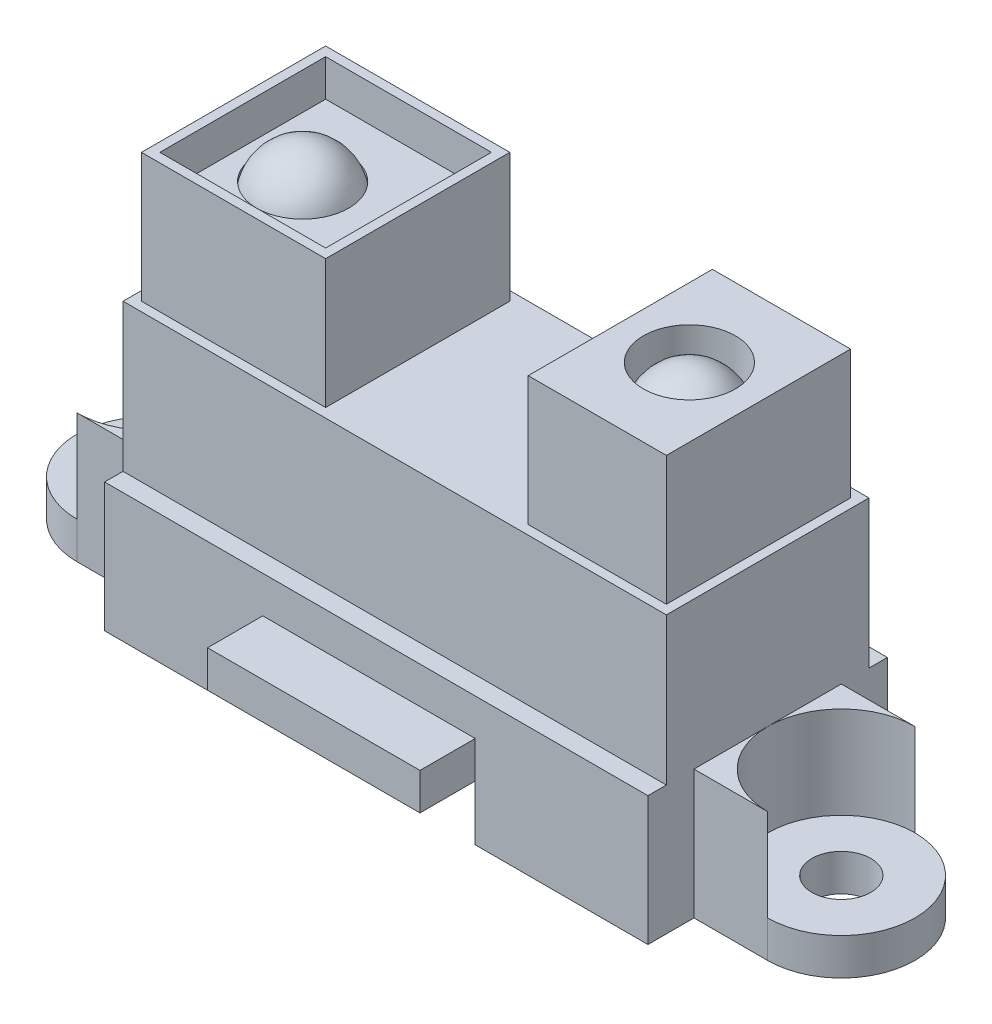
from build123d import *

# Parameters (mm, degrees)
EXTRUDE_1_DEPTH     = 7
CUT_EXTRUDE_START   = -5
SKETCH_2_R          = 4
CUT_EXTRUDE_1_DEPTH = 5
SKETCH_3_W          = 29.5
SKETCH_3_H          = 11
EXTRUDE_2_DEPTH     = 8
SKETCH_4_W          = 7.5
SKETCH_4_H          = 10
SKETCH_4_W_2        = 10
EXTRUDE_3_DEPTH     = 7
SKETCH_5_W          = 9
SKETCH_5_H          = 9
CUT_EXTRUDE_2_DEPTH = 2
SKETCH_6_R          = 2.5
CUT_EXTRUDE_3_DEPTH = 2.2
SKETCH_7_R          = 1.6
CUT_EXTRUDE_4_DEPTH = 45.443784717
SKETCH_8_W          = 11.533749137
SKETCH_8_H          = 5
EXTRUDE_4_DEPTH     = 3
CUT_EXTRUDE_5_DEPTH = 3


# Read off the part's stored shape, not the designer's step: 圆顶1, 圆顶2
with BuildPart() as part:
    # 草图1 → 凸台-拉伸1 (new body)
    with BuildSketch(Plane(origin=(0, 0, 0), x_dir=(1, 0, 0), z_dir=(0, 1, 0))):
        with BuildLine():
            Line((0, 0), (29.5, 0))
            Line((29.5, 0), (29.5, -2.5))
            Line((29.5, -2.5), (33.5, -2.5))
            ThreePointArc((33.5, -2.5), (37.5, -6.5), (33.5, -10.5))
            Line((33.5, -10.5), (29.5, -10.5))
            Line((29.5, -10.5), (29.5, -13))
            Line((29.5, -13), (0, -13))
            Line((0, -13), (0, -10.5))
            Line((0, -10.5), (-4, -10.5))
            ThreePointArc((-4, -10.5), (-8, -6.5), (-4, -2.5))
            Line((-4, -2.5), (0, -2.5))
            Line((0, -2.5), (0, 0))
        make_face()
    extrude(amount=EXTRUDE_1_DEPTH)

    # 草图2 → 切除-拉伸1 (cut)
    with BuildSketch(Plane(origin=(0, 7, 0), x_dir=(1, 0, 0), z_dir=(0, 1, 0)).offset(CUT_EXTRUDE_START)):
        with Locations((-4, -6.5)):
            Circle(SKETCH_2_R)
        with Locations((33.5, -6.5)):
            Circle(SKETCH_2_R)
    extrude(amount=CUT_EXTRUDE_1_DEPTH, mode=Mode.SUBTRACT)

    # 草图3 → 凸台-拉伸2 (add)
    with BuildSketch(Plane(origin=(0, 7, 0), x_dir=(1, 0, 0), z_dir=(0, 1, 0))):
        with Locations((14.75, -6.5)):
            Rectangle(SKETCH_3_W, SKETCH_3_H)
    extrude(amount=EXTRUDE_2_DEPTH)

    # 草图4 → 凸台-拉伸3 (add)
    with BuildSketch(Plane(origin=(0, 15, 0), x_dir=(1, 0, 0), z_dir=(0, 1, 0))):
        with Locations((25.25, -6.5)):
            Rectangle(SKETCH_4_W, SKETCH_4_H)
        with Locations((5.5, -6.5)):
            Rectangle(SKETCH_4_W_2, SKETCH_4_H)
    extrude(amount=EXTRUDE_3_DEPTH)

    # 草图5 → 切除-拉伸2 (cut)
    with BuildSketch(Plane(origin=(0, 22, 0), x_dir=(1, 0, 0), z_dir=(0, 1, 0))):
        with Locations((5.5, -6.5)):
            Rectangle(SKETCH_5_W, SKETCH_5_H)
    extrude(amount=-CUT_EXTRUDE_2_DEPTH, mode=Mode.SUBTRACT)

    # 草图6 → 切除-拉伸3 (cut)
    with BuildSketch(Plane(origin=(0, 22, 0), x_dir=(1, 0, 0), z_dir=(0, 1, 0))):
        with Locations(Location((25.25, -6.5, 0), (0, 0, 270))):
            Circle(SKETCH_6_R)
        with Locations(Location((4.253331237, -6.5, 0), (0, 0, 270))):
            Circle(SKETCH_6_R)
    extrude(amount=-CUT_EXTRUDE_3_DEPTH, mode=Mode.SUBTRACT)

    # 圆顶1 outline → 圆顶1 (revolve)
    with BuildSketch(Plane(origin=(4.253331237, 0, 6.5), x_dir=(1, 0, 0), z_dir=(0, 0, 1))):
        with BuildLine():
            Line((0, 19.8), (2.500000001, 19.799999998))
            ThreePointArc((2.500000001, 19.799999998), (1.60078106, 21.238476323), (0, 21.8))
            Line((0, 21.8), (0, 19.8))
        make_face()
    revolve(axis=Axis((4.253331237, 0, 6.5), (0, 1, 0)))

    # 圆顶2 outline → 圆顶2 (revolve)
    with BuildSketch(Plane(origin=(25.25, 0, 6.5), x_dir=(1, 0, 0), z_dir=(0, 0, 1))):
        with BuildLine():
            Line((0, 19.8), (2.500000001, 19.799999997))
            ThreePointArc((2.500000001, 19.799999997), (1.60078106, 21.238476323), (0, 21.8))
            Line((0, 21.8), (0, 19.8))
        make_face()
    revolve(axis=Axis((25.25, 0, 6.5), (0, 1, 0)))

    # 草图7 → 切除-拉伸4 (cut, through all)
    with BuildSketch(Plane(origin=(0, 2, 0), x_dir=(1, 0, 0), z_dir=(0, 1, 0))):
        with Locations(Location((-4, -6.5, 0), (0, 0, 270))):
            Circle(SKETCH_7_R)
        with Locations(Location((33.5, -6.5, 0), (0, 0, 270))):
            Circle(SKETCH_7_R)
    extrude(amount=-CUT_EXTRUDE_4_DEPTH, mode=Mode.SUBTRACT)

    # 草图8 → 凸台-拉伸4 (add)
    with BuildSketch(Plane.XY.offset(13)):
        with Locations((14.355989937, 2.5)):
            Rectangle(SKETCH_8_W, SKETCH_8_H)
    extrude(amount=EXTRUDE_4_DEPTH)

    # 草图10 → 切除-拉伸5 (cut)
    with BuildSketch(Plane.XZ):
        Polygon((8.589115368, 16), (8.589115368, 12), (1, 12), (1, 1), (28.5, 1), (28.5, 12), (20.122864505, 12), (20.122864505, 16), align=None)
    extrude(amount=-CUT_EXTRUDE_5_DEPTH, mode=Mode.SUBTRACT)


solid = part.part
